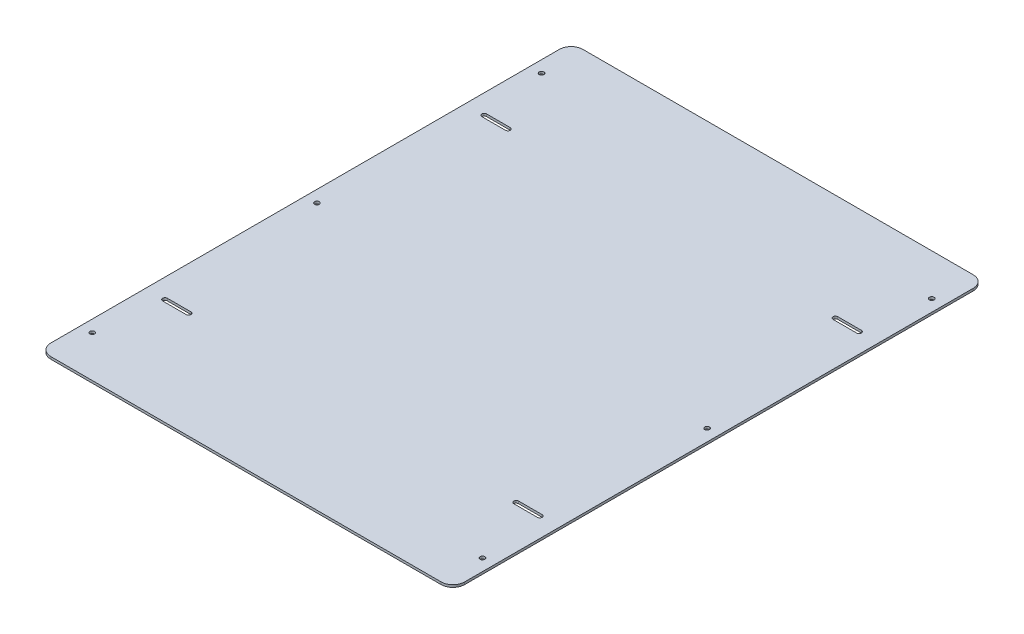
from build123d import *

# Parameters (mm, degrees)
SKETCH_1_R             = 2
SM_BASE_FLANGE_1_DEPTH = 2


# Sheet-metal steps are written as plain solids
with BuildPart() as part:
    # Sketch 1 → 基体-法兰1 (new body)
    with BuildSketch(Plane(origin=(0, 0, 0), x_dir=(1, 0, 0), z_dir=(0, 1, 0))):
        with BuildLine():
            Line((-165, 225), (165, 225))
            ThreePointArc((165, 225), (172.071067812, 222.071067812), (175, 215))
            Line((175, 215), (175, -215))
            ThreePointArc((175, -215), (172.071067812, -222.071067812), (165, -225))
            Line((165, -225), (-165, -225))
            ThreePointArc((-165, -225), (-172.071067812, -222.071067812), (-175, -215))
            Line((-175, -215), (-175, 215))
            ThreePointArc((-175, 215), (-172.071067812, 222.071067812), (-165, 225))
        make_face()
        with Locations(Location((-165, 190, 0), (0, 0, 270))):
            Circle(SKETCH_1_R, mode=Mode.SUBTRACT)
        with Locations(Location((165, 190, 0), (0, 0, 270))):
            Circle(SKETCH_1_R, mode=Mode.SUBTRACT)
        with Locations(Location((165, 0, 0), (0, 0, 270))):
            Circle(SKETCH_1_R, mode=Mode.SUBTRACT)
        with Locations(Location((165, -190, 0), (0, 0, 270))):
            Circle(SKETCH_1_R, mode=Mode.SUBTRACT)
        with Locations(Location((-165, -190, 0), (0, 0, 270))):
            Circle(SKETCH_1_R, mode=Mode.SUBTRACT)
        with Locations(Location((-165, 0, 0), (0, 0, 270))):
            Circle(SKETCH_1_R, mode=Mode.SUBTRACT)
        with BuildLine():
            Line((-158.5, 137), (-138.5, 137))
            ThreePointArc((-138.5, 137), (-136.5, 135), (-138.5, 133))
            Line((-138.5, 133), (-158.5, 133))
            ThreePointArc((-158.5, 133), (-160.5, 135), (-158.5, 137))
        make_face(mode=Mode.SUBTRACT)
        with BuildLine():
            Line((138.5, 137), (158.5, 137))
            ThreePointArc((158.5, 137), (160.5, 135), (158.5, 133))
            Line((158.5, 133), (138.5, 133))
            ThreePointArc((138.5, 133), (136.5, 135), (138.5, 137))
        make_face(mode=Mode.SUBTRACT)
        with BuildLine():
            Line((-158.5, -137), (-138.5, -137))
            ThreePointArc((-138.5, -137), (-136.5, -135), (-138.5, -133))
            Line((-138.5, -133), (-158.5, -133))
            ThreePointArc((-158.5, -133), (-160.5, -135), (-158.5, -137))
        make_face(mode=Mode.SUBTRACT)
        with BuildLine():
            Line((138.5, -137), (158.5, -137))
            ThreePointArc((158.5, -137), (160.5, -135), (158.5, -133))
            Line((158.5, -133), (138.5, -133))
            ThreePointArc((138.5, -133), (136.5, -135), (138.5, -137))
        make_face(mode=Mode.SUBTRACT)
    extrude(amount=-SM_BASE_FLANGE_1_DEPTH)


solid = part.part
